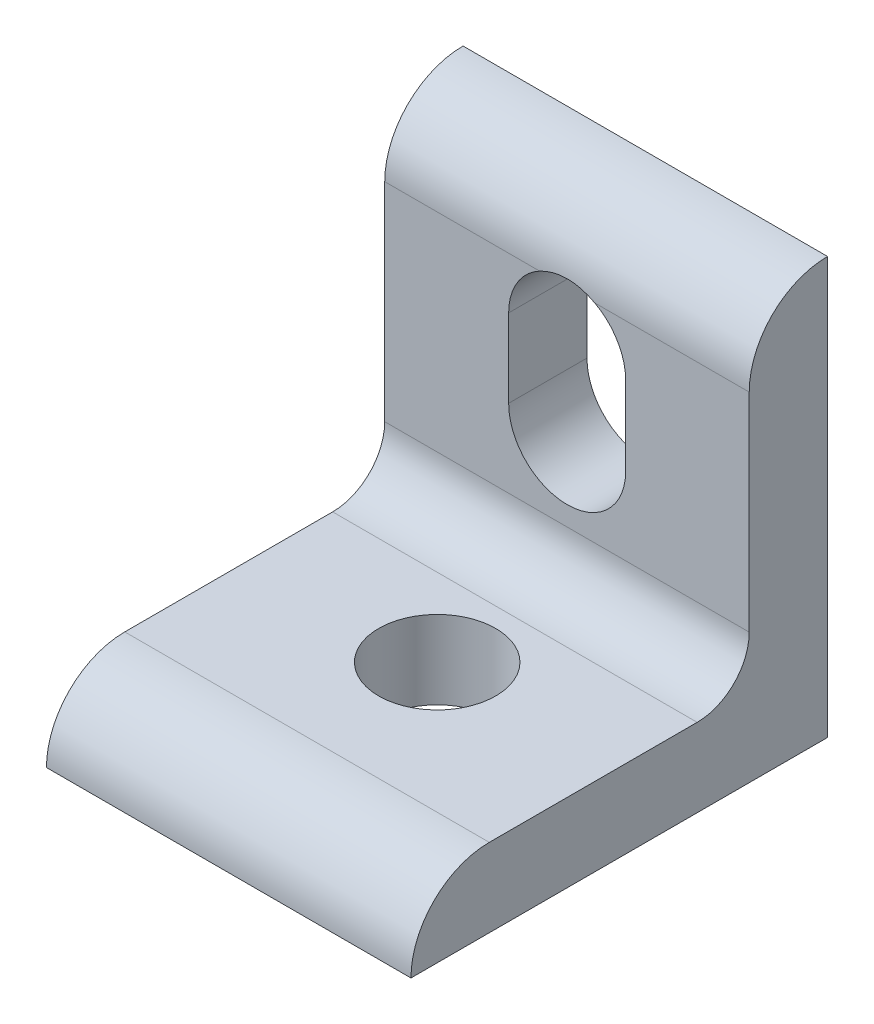
from build123d import *

# Parameters (mm, degrees)
EXTRUDE1_DEPTH     = 22.225
SKETCH2_R          = 3.5687
CUT_EXTRUDE1_DEPTH = 30.714556856
FILLET1_R          = 3.175
CUT_EXTRUDE2_DEPTH = 59.612502088


with BuildPart() as part:
    # Sketch1 → Extrude1 (new body)
    with BuildSketch(Plane(origin=(0, 0, 0), x_dir=(0, 0, -1), z_dir=(1, 0, 0))):
        with BuildLine():
            Line((6.263601982, 22.519878715), (-19.136398018, 22.519878715))
            ThreePointArc((-19.136398018, 22.519878715), (-17.737774319, 25.896455016), (-14.361198018, 27.295078715))
            Line((-14.361198018, 27.295078715), (1.488401982, 27.295078715))
            Line((1.488401982, 27.295078715), (6.263601982, 22.519878715))
        make_face()
    extrude(amount=EXTRUDE1_DEPTH)

    # Sketch2 → Cut-Extrude1 (cut, through all)
    with BuildSketch(Plane(origin=(0, 27.295078715, 0), x_dir=(1, 0, 0), z_dir=(0, 1, 0))):
        with Locations((11.1252, -6.436398018)):
            Circle(SKETCH2_R)
    extrude(amount=-CUT_EXTRUDE1_DEPTH, mode=Mode.SUBTRACT)

    # Mirror1: part across plane


with BuildPart() as part_1:
    add(part.part)
    add(part.part.mirror(Plane(origin=(22.225, 22.519878715, -6.263601982), x_dir=(0, 0.7071067811865436, 0.7071067811865515), z_dir=(0, -0.7071067811865515, 0.7071067811865436))))

    # Fillet1
    fillet1_edges = [part_1.edges().sort_by_distance(p)[0] for p in [
        (11.1125, 27.295078715, -1.488401982),
    ]]
    fillet(fillet1_edges, radius=FILLET1_R)

    # Sketch3 → Cut-Extrude2 (cut, through all)
    with BuildSketch(Plane(origin=(0, 0, -6.263601982), x_dir=(-1, 0, 0), z_dir=(0, 0, -1))):
        with BuildLine():
            Line((-14.6939, 39.995078715), (-14.6939, 35.219878715))
            Line((-14.6939, 35.219878715), (-7.5565, 35.219878715))
            Line((-7.5565, 35.219878715), (-7.5565, 39.995078715))
            ThreePointArc((-7.5565, 39.995078715), (-11.1252, 43.563778715), (-14.6939, 39.995078715))
        make_face()
    extrude(amount=-CUT_EXTRUDE2_DEPTH, mode=Mode.SUBTRACT)


solid = part_1.part
